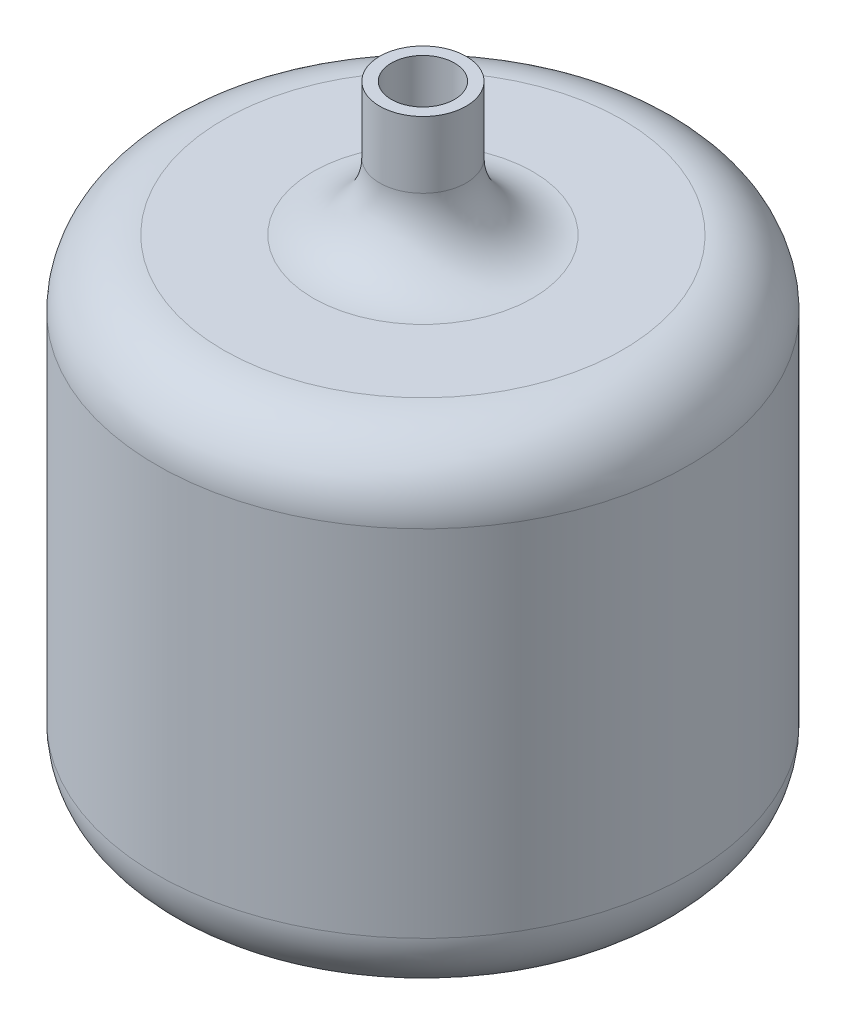
from build123d import *

# Parameters (mm, degrees)
ESQUISSE1_W                  = 63
ESQUISSE1_H                  = 7.5
ESQUISSE2_R                  = 5.5
ENL_V_MAT_EXTRU_1_DEPTH      = 33
R_P_TITION_CIRCULAIRE1_COUNT = 15
CONG_1_R                     = 10
CONG_2_R                     = 10
ESQUISSE3_R                  = 6.5
ESQUISSE3_R_2                = 4.75
BOSS_EXTRU_1_DEPTH           = 20
CONG_3_R                     = 10


with BuildPart() as part:
    # Esquisse1 → Révolution1 (revolve)
    with BuildSketch(Plane(origin=(0, 0, 0), x_dir=(0, 1, 0), z_dir=(0, 0, 1)), mode=Mode.PRIVATE) as r_volution1_sk:
        with Locations((0.429824561, -36.25)):
            Rectangle(ESQUISSE1_W, ESQUISSE1_H)
        Polygon((41.929824561, 0), (31.929824561, 0), (31.929824561, -32.5), (31.929824561, -40), (41.929824561, -40), align=None)
    revolve(r_volution1_sk.sketch.rotate(Axis((0, 0, 0), (0, 1, 0)), 90), axis=Axis((0, 0, 0), (0, 1, 0)))

    # Esquisse2 → Enlèv. mat.-Extru.1 (cut)
    with BuildSketch(Plane.YZ):
        with Locations(Location((-21.070175439, 0, 0), (0, 0, 270))):
            Circle(ESQUISSE2_R)
        with Locations(Location((-6.070175439, 0, 0), (0, 0, 270))):
            Circle(ESQUISSE2_R)
        with Locations(Location((8.929824561, 0, 0), (0, 0, 270))):
            Circle(ESQUISSE2_R)
        with Locations(Location((23.929824561, 0, 0), (0, 0, 270))):
            Circle(ESQUISSE2_R)
    enl_v_mat_extru_1 = extrude(amount=-ENL_V_MAT_EXTRU_1_DEPTH, mode=Mode.SUBTRACT)

    # Répétition circulaire1: Enlèv. mat.-Extru.1 ×15 about axis
    r_p_tition_circulaire1_axis = Axis((0, 0, 0), (0, 1, 0))
    for i in range(1, R_P_TITION_CIRCULAIRE1_COUNT):
        add(enl_v_mat_extru_1.rotate(r_p_tition_circulaire1_axis, i * 360 / R_P_TITION_CIRCULAIRE1_COUNT), mode=Mode.SUBTRACT)

    # Congé1
    cong_1_edges = [part.edges().sort_by_distance(p)[0] for p in [
        (0, 41.929824561, 40),
    ]]
    fillet(cong_1_edges, radius=CONG_1_R)

    # Congé2
    # the kernel refuses this fillet: 10 mm, written as the material it takes off along each edge
    with BuildSketch(Plane(origin=(0, -31.070175439, 0), x_dir=(0, 0, -1), z_dir=(1, 0, 0))) as cong_2_piece_1:
        with BuildLine():
            CenterArc((30, 9.682458366), CONG_2_R, 284.477512186, 75.522487814)
            Line((32.5, 0), (32.55, -0.193649167))
            ThreePointArc((32.55, -0.193649167), (36.25, -0.2), (40, -0.2))
            Line((40, -0.2), (40.2, 0))
            Line((40.2, 0), (40.2, 9.682458366))
            Line((40.2, 9.682458366), (40, 9.682458366))
        make_face()
    revolve(axis=Axis((0, -31.070175439, 0), (0, 1, 0)), mode=Mode.SUBTRACT)

    # Esquisse3 → Boss.-Extru.1 (add)
    with BuildSketch(Plane(origin=(0, 41.929824561, 0), x_dir=(-1, 0, 0), z_dir=(0, 1, 0))):
        with Locations(Location((0, 0, 0), (0, 0, 270))):
            Circle(ESQUISSE3_R)
        with Locations(Location((0, 0, 0), (0, 0, 90))):
            Circle(ESQUISSE3_R_2, mode=Mode.SUBTRACT)
    extrude(amount=BOSS_EXTRU_1_DEPTH)

    # Congé3
    cong_3_edges = [part.edges().sort_by_distance(p)[0] for p in [
        (0, 41.929824561, 6.5),
    ]]
    fillet(cong_3_edges, radius=CONG_3_R)


solid = part.part
